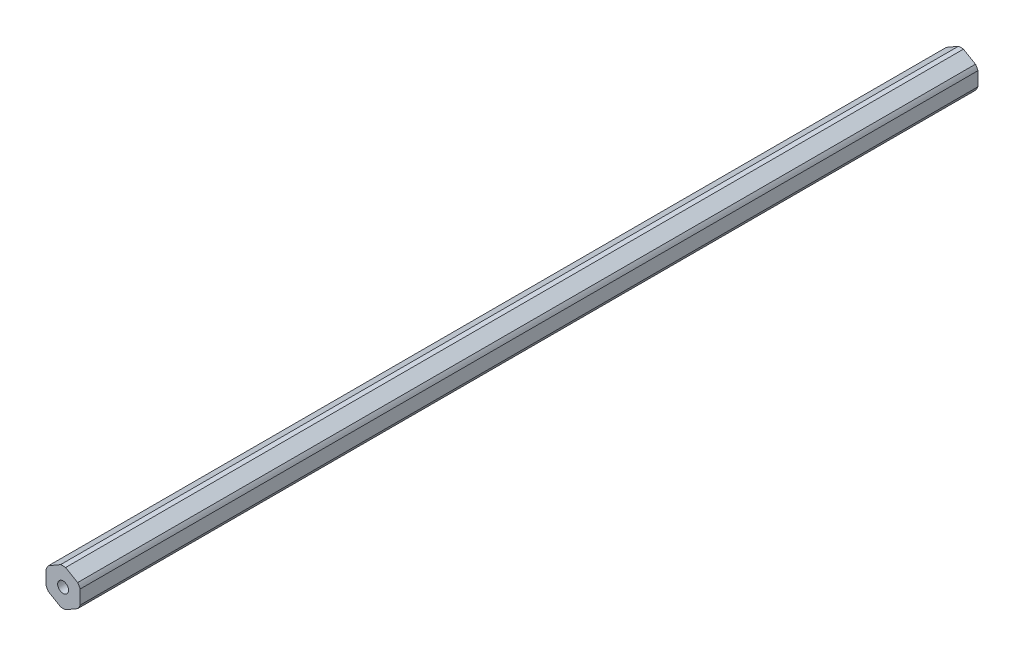
from build123d import *

# Parameters (mm, degrees)
BOSS_EXTRUDE1_DEPTH = 166.8145
SKETCH2_R           = 2.0193
CUT_EXTRUDE1_DEPTH  = 334.759890198


with BuildPart() as part:
    # Sketch1 → Boss-Extrude1 (new, symmetric)
    with BuildSketch(Plane.XY):
        with BuildLine():
            ThreePointArc((0.93173274, 6.79441227), (0, 6.858), (-0.93173274, 6.79441227))
            Line((-0.93173274, 6.79441227), (-5.41826726, 4.204110358))
            ThreePointArc((-5.41826726, 4.204110358), (-5.939202219, 3.429), (-6.35, 2.590301913))
            Line((-6.35, 2.590301913), (-6.35, -2.590301913))
            ThreePointArc((-6.35, -2.590301913), (-5.939202219, -3.429), (-5.41826726, -4.204110358))
            Line((-5.41826726, -4.204110358), (-0.93173274, -6.79441227))
            ThreePointArc((-0.93173274, -6.79441227), (0, -6.858), (0.93173274, -6.79441227))
            Line((0.93173274, -6.79441227), (5.41826726, -4.204110358))
            ThreePointArc((5.41826726, -4.204110358), (5.939202219, -3.429), (6.35, -2.590301913))
            Line((6.35, -2.590301913), (6.35, 2.590301913))
            ThreePointArc((6.35, 2.590301913), (5.939202219, 3.429), (5.41826726, 4.204110358))
            Line((5.41826726, 4.204110358), (0.93173274, 6.79441227))
        make_face()
    extrude(amount=BOSS_EXTRUDE1_DEPTH, both=True)

    # Sketch2 → Cut-Extrude1 (cut, through all)
    with BuildSketch(Plane.XY.offset(166.8145)):
        Circle(SKETCH2_R)
    extrude(amount=-CUT_EXTRUDE1_DEPTH, mode=Mode.SUBTRACT)


solid = part.part
